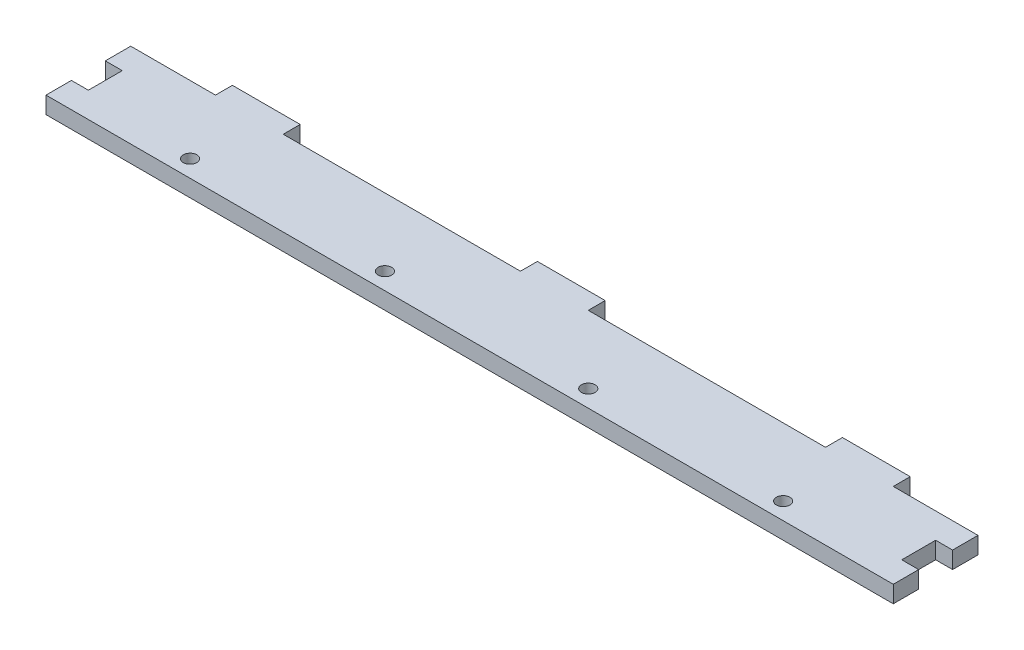
from build123d import *

# Parameters (mm, degrees)
SKETCH1_R           = 2
BOSS_EXTRUDE1_DEPTH = 5


with BuildPart() as part:
    # Sketch1 → Boss-Extrude1 (new body)
    with BuildSketch(Plane(origin=(0, 0, 0), x_dir=(1, 0, 0), z_dir=(0, 1, 0))):
        Polygon((-125, 12.5), (-100, 12.5), (-100, 17.5), (-80, 17.5), (-80, 12.5), (-10, 12.5), (-10, 17.5), (10, 17.5), (10, 12.5), (80, 12.5), (80, 17.5), (100, 17.5), (100, 12.5), (125, 12.5), (125, 5), (120, 5), (120, -5), (125, -5), (125, -12.5), (-125, -12.5), (-125, -5), (-120, -5), (-120, 5), (-125, 5), align=None)
        with Locations((-30, -7.5)):
            Circle(SKETCH1_R, mode=Mode.SUBTRACT)
        with Locations((-87.5, -7.5)):
            Circle(SKETCH1_R, mode=Mode.SUBTRACT)
        with Locations((30, -7.5)):
            Circle(SKETCH1_R, mode=Mode.SUBTRACT)
        with Locations((87.5, -7.5)):
            Circle(SKETCH1_R, mode=Mode.SUBTRACT)
    extrude(amount=BOSS_EXTRUDE1_DEPTH)


solid = part.part
